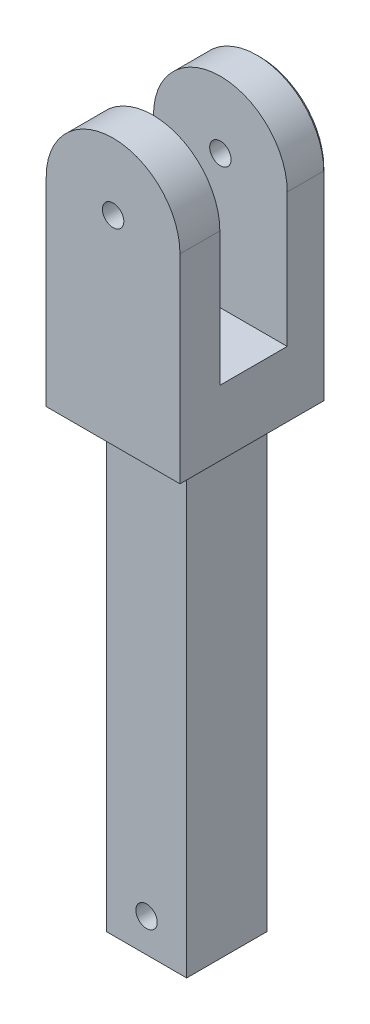
from build123d import *

# Parameters (mm, degrees)
EXTRUDE_1_DEPTH     = 12
CUT_EXTRUDE_1_DEPTH = 39.218600963
CUT_EXTRUDE_6_DEPTH = 39.218600963
SKETCH_12_R         = 1.6
EXTRUDE_11_DEPTH    = 5
EXTRUDE_START       = 5
SKETCH_13_R         = 1.6
EXTRUDE_12_DEPTH    = 5
SKETCH_14_W         = 10.08
SKETCH_14_H         = 30
CUT_EXTRUDE_7_DEPTH = 41.070705753
SKETCH_15_W         = 12
SKETCH_15_H         = 12
EXTRUDE_13_DEPTH    = 68
CUT_EXTRUDE_8_DEPTH = 101.235992767
CHAMFER_1_SIZE      = 0.5


with BuildPart() as part:
    # 草圖1 → 填料-伸長1 (new body)
    with BuildSketch(Plane.XY):
        with BuildLine():
            ThreePointArc((10, 0), (0, 10), (-10, 0))
            Line((-10, 0), (-10, -30.276417548))
            Line((-10, -30.276417548), (10, -30.276417548))
            Line((10, -30.276417548), (10, 0))
        make_face()
        with BuildLine():
            ThreePointArc((0, -1.6), (-1.13137085, 1.13137085), (1.6, 0))
            ThreePointArc((1.6, 0), (1.13137085, -1.13137085), (0, -1.6))
        make_face(mode=Mode.SUBTRACT)
    extrude(amount=EXTRUDE_1_DEPTH)

    # 草圖2 → 除料-伸長1 (cut, through all)
    with BuildSketch(Plane(origin=(10, 0, 0), x_dir=(0, 0, -1), z_dir=(1, 0, 0))):
        Polygon((-9, 15.780779257), (-9, 0), (-8.60053373, -20), (-3, -20), (-3, 15.780779257), align=None)
    extrude(amount=-CUT_EXTRUDE_1_DEPTH, mode=Mode.SUBTRACT)

    # 草圖11 → 除料-伸長6 (cut, through all)
    with BuildSketch(Plane(origin=(10, 0, 0), x_dir=(0, 0, -1), z_dir=(1, 0, 0))):
        Polygon((-9, 0), (-9, -20), (-8.60053373, -20), align=None)
    extrude(amount=-CUT_EXTRUDE_6_DEPTH, mode=Mode.SUBTRACT)

    # 草圖12 → 填料-伸長11 (add)
    with BuildSketch(Plane.XY.offset(12)):
        with BuildLine():
            Line((10, -30.276417548), (10, 0))
            ThreePointArc((10, 0), (0, 10), (-10, 0))
            Line((-10, 0), (-10, -30.276417548))
            Line((-10, -30.276417548), (10, -30.276417548))
        make_face()
        Circle(SKETCH_12_R, mode=Mode.SUBTRACT)
    extrude(amount=EXTRUDE_11_DEPTH)

    # 草圖13 → 填料-伸長12 (add)
    with BuildSketch(Plane(origin=(0, 0, 0), x_dir=(-1, 0, 0), z_dir=(0, 0, -1)).offset(EXTRUDE_START)):
        with BuildLine():
            Line((10, -30.276417548), (10, 0))
            ThreePointArc((10, 0), (0, 10), (-10, 0))
            Line((-10, 0), (-10, -30.276417548))
            Line((-10, -30.276417548), (10, -30.276417548))
        make_face()
        Circle(SKETCH_13_R, mode=Mode.SUBTRACT)
    extrude(amount=-EXTRUDE_12_DEPTH)

    # 草圖14 → 除料-伸長7 (cut, through all)
    with BuildSketch(Plane.ZY.offset(10)):
        with Locations((6, -5)):
            Rectangle(SKETCH_14_W, SKETCH_14_H)
    extrude(amount=-CUT_EXTRUDE_7_DEPTH, mode=Mode.SUBTRACT)

    # 草圖15 → 填料-伸長13 (add)
    with BuildSketch(Plane.XZ.offset(30.276417548)):
        with Locations((0, 6)):
            Rectangle(SKETCH_15_W, SKETCH_15_H)
    extrude(amount=EXTRUDE_13_DEPTH)

    # 草圖17 → 除料-伸長8 (cut, through all)
    with BuildSketch(Plane(origin=(0, 0, 0), x_dir=(-1, 0, 0), z_dir=(0, 0, -1))):
        with BuildLine():
            ThreePointArc((0, -94.876417548), (1.13137085, -94.407788398), (1.6, -93.276417548))
            ThreePointArc((1.6, -93.276417548), (-1.13137085, -92.145046698), (0, -94.876417548))
        make_face()
    extrude(amount=-CUT_EXTRUDE_8_DEPTH, mode=Mode.SUBTRACT)

    # 導角1
    chamfer_1_edges = [part.edges().sort_by_distance(p)[0] for p in [
        (-10, -15.138208774, -5),
        (0, -30.276417548, -5),
        (0, 10, -5),
        (10, -15.138208774, -5),
        (-10, -30.276417548, 6),
        (0, -30.276417548, 17),
        (10, -30.276417548, 6),
    ]]
    chamfer(chamfer_1_edges, length=CHAMFER_1_SIZE)


solid = part.part
